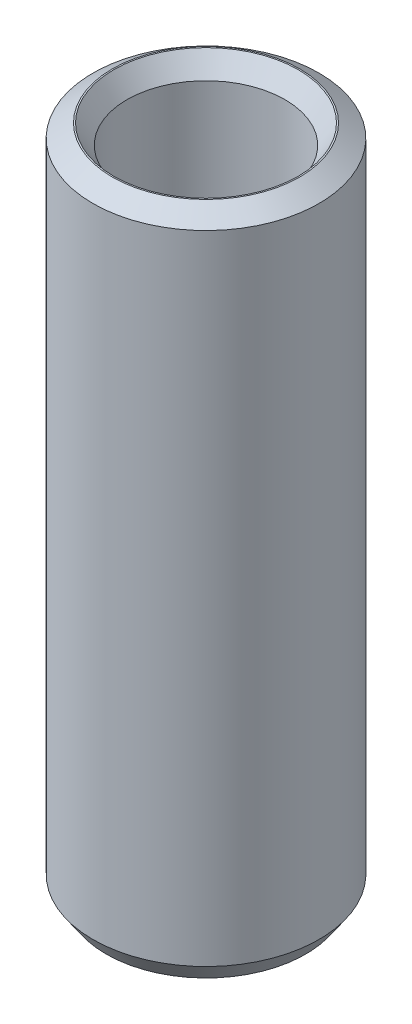
from build123d import *
from OCP.BRepFilletAPI import BRepFilletAPI_MakeChamfer

# Parameters (mm, degrees)
SKETCH1_R           = 10
BOSS_EXTRUDE1_DEPTH = 59.270766618
SKETCH2_R           = 6.992130718
CUT_EXTRUDE1_DEPTH  = 61.934586037
CHAMFER1_SIZE       = 1.172804644
CHAMFER1_SIZE2      = 1.707949939


with BuildPart() as part:
    # Sketch1 → Boss-Extrude1 (new body)
    with BuildSketch(Plane(origin=(0, 0, 0), x_dir=(1, 0, 0), z_dir=(0, 1, 0))):
        Circle(SKETCH1_R)
    extrude(amount=BOSS_EXTRUDE1_DEPTH)

    # Sketch2 → Cut-Extrude1 (cut, through all)
    with BuildSketch(Plane(origin=(0, 0, 0), x_dir=(1, 0, 0), z_dir=(0, 1, 0))):
        Circle(SKETCH2_R)
    extrude(amount=CUT_EXTRUDE1_DEPTH, mode=Mode.SUBTRACT)

    # Chamfer1: one chamfer whose edges measure the first distance from different faces: ONE call of the kernel's chamfer builder (chamfer() names one face for all edges)
    chamfer1_edges_1 = [part.edges().sort_by_distance(p)[0] for p in [
        (-6.992130718, 59.270766618, 0),
    ]]
    chamfer1_side_1 = [part.faces().sort_by_distance(p)[0] for p in [
        (-9.717157288, 59.270766618, 0),
    ]]
    chamfer1_edges_2 = [part.edges().sort_by_distance(p)[0] for p in [
        (-6.992130718, 0, 0),
    ]]
    chamfer1_side_2 = [part.faces().sort_by_distance(p)[0] for p in [
        (-6.992130718, 29.635383309, 0),
    ]]
    chamfer1_edges_3 = [part.edges().sort_by_distance(p)[0] for p in [
        (-10, 0, 0),
    ]]
    chamfer1_side_3 = [part.faces().sort_by_distance(p)[0] for p in [
        (-9.717157288, 0, 0),
    ]]
    chamfer1_edges_4 = [part.edges().sort_by_distance(p)[0] for p in [
        (-10, 59.270766618, 0),
    ]]
    chamfer1_side_4 = [part.faces().sort_by_distance(p)[0] for p in [
        (-10, 29.635383309, 0),
    ]]
    chamfer1 = BRepFilletAPI_MakeChamfer(part.part.solid().wrapped)
    for e in chamfer1_edges_1:
        chamfer1.Add(CHAMFER1_SIZE, CHAMFER1_SIZE2, e.wrapped, chamfer1_side_1[0].wrapped)  # the first distance lies on this face
    for e in chamfer1_edges_2:
        chamfer1.Add(CHAMFER1_SIZE, CHAMFER1_SIZE2, e.wrapped, chamfer1_side_2[0].wrapped)  # the first distance lies on this face
    for e in chamfer1_edges_3:
        chamfer1.Add(CHAMFER1_SIZE, CHAMFER1_SIZE2, e.wrapped, chamfer1_side_3[0].wrapped)  # the first distance lies on this face
    for e in chamfer1_edges_4:
        chamfer1.Add(CHAMFER1_SIZE, CHAMFER1_SIZE2, e.wrapped, chamfer1_side_4[0].wrapped)  # the first distance lies on this face
    add(Compound.cast(chamfer1.Shape()), mode=Mode.REPLACE)


solid = part.part
